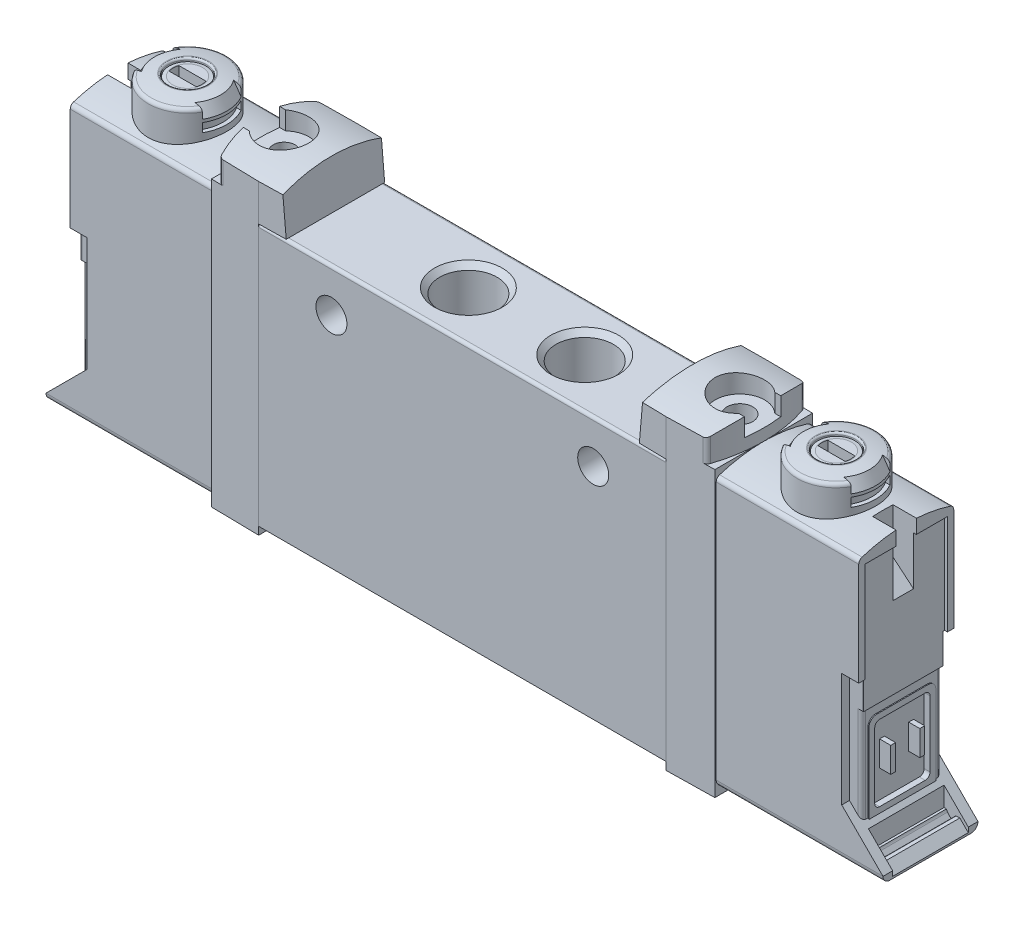
from build123d import *

# Parameters (mm, degrees)
BOSS_EXTRUDE1_DEPTH      = 21
BOSS_EXTRUDE1_DEPTH_BACK = 21
CUT_EXTRUDE1_DEPTH       = 6
CUT_EXTRUDE1_DEPTH_BACK  = 6
SKETCH2_R                = 1.6
CUT_EXTRUDE2_DEPTH       = 6
CUT_EXTRUDE2_DEPTH_BACK  = 6
SKETCH3_R                = 1.6
HOLE1_D                  = 5.917
HOLE1_DEPTH              = 6.8
HOLE1_CSINK_D            = 7
HOLE1_CSINK_ANGLE        = 90
HOLE2_D                  = 5.917
HOLE2_DEPTH              = 6.8
HOLE2_CSINK_D            = 7
HOLE2_CSINK_ANGLE        = 90
HOLE3_D                  = 3
HOLE3_DEPTH              = 6.7
HOLE4_D                  = 3
HOLE4_DEPTH              = 6.7
BOSS_EXTRUDE2_DEPTH      = 32.5
BOSS_EXTRUDE3_DEPTH      = 4.7
CUT_EXTRUDE3_DEPTH       = 5
CUT_EXTRUDE4_DEPTH       = 6
CUT_EXTRUDE4_DEPTH_BACK  = 6
BOSS_EXTRUDE4_DEPTH      = 17.2
CUT_EXTRUDE5_DEPTH       = 6
CUT_EXTRUDE5_DEPTH_BACK  = 6
BOSS_EXTRUDE5_DEPTH      = 12
BOSS_EXTRUDE6_DEPTH      = 3.1
BOSS_EXTRUDE7_DEPTH      = 0.1
CUT_EXTRUDE6_DEPTH       = 0.5
CUT_EXTRUDE6_DEPTH_BACK  = 0.5
BOSS_EXTRUDE8_DEPTH      = 2.6
CUT_EXTRUDE7_DEPTH       = 3
BOSS_EXTRUDE9_DEPTH      = 32.5
BOSS_EXTRUDE10_DEPTH     = 4.7
CUT_EXTRUDE8_DEPTH       = 32
CUT_EXTRUDE8_DEPTH_BACK  = 32
CUT_EXTRUDE9_DEPTH       = 2
CUT_EXTRUDE10_DEPTH      = 6
CUT_EXTRUDE10_DEPTH_BACK = 6
CUT_EXTRUDE11_DEPTH      = 5
BOSS_EXTRUDE11_START     = -17.2
BOSS_EXTRUDE11_DEPTH     = 17.2
CUT_EXTRUDE12_DEPTH      = 6
CUT_EXTRUDE12_DEPTH_BACK = 6
BOSS_EXTRUDE12_DEPTH     = 12
BOSS_EXTRUDE13_DEPTH     = 3.1
BOSS_EXTRUDE14_START     = -0.1
BOSS_EXTRUDE14_DEPTH     = 0.1
CUT_EXTRUDE13_DEPTH      = 0.5
CUT_EXTRUDE13_DEPTH_BACK = 0.5
BOSS_EXTRUDE15_DEPTH     = 2.6
SKETCH43_W               = 4.05
SKETCH43_H               = 5.3
SKETCH44_W               = 4.05
SKETCH44_H               = 5.3
SKETCH47_R               = 6
CUT_EXTRUDE14_DEPTH      = 3
SKETCH48_R               = 6
CUT_EXTRUDE15_DEPTH      = 3
CUT_EXTRUDE16_DEPTH      = 2.15
CUT_EXTRUDE17_DEPTH      = 2.15
CUT_EXTRUDE18_DEPTH      = 3.9
CUT_EXTRUDE18_DEPTH_BACK = 3.9
CUT_EXTRUDE19_DEPTH      = 3.9
CUT_EXTRUDE19_DEPTH_BACK = 3.9
CUT_EXTRUDE20_DEPTH      = 1.05
CUT_EXTRUDE20_DEPTH_BACK = 1.05
CUT_EXTRUDE21_DEPTH      = 1.05
CUT_EXTRUDE21_DEPTH_BACK = 1.05
CUT_EXTRUDE22_DEPTH      = 3.9
CUT_EXTRUDE22_DEPTH_BACK = 3.9
CUT_EXTRUDE23_DEPTH      = 3.9
CUT_EXTRUDE23_DEPTH_BACK = 3.9
CUT_EXTRUDE24_DEPTH      = 3.9
CUT_EXTRUDE24_DEPTH_BACK = 3.9
SKETCH62_W               = 8.5
SKETCH62_H               = 14
CUT_EXTRUDE25_DEPTH      = 2.8
SKETCH63_W               = 8.5
SKETCH63_H               = 14
CUT_EXTRUDE26_DEPTH      = 2.8


with BuildPart() as part:
    # Sketch1 → Boss-Extrude1 (new, two sides: drawn at the far end of the back side and taken through both)
    with BuildSketch(Plane(origin=(0, 0, 0), x_dir=(0, 0, -1), z_dir=(1, 0, 0)).offset(-BOSS_EXTRUDE1_DEPTH_BACK)):
        with BuildLine():
            Line((-5.125, 0), (5.125, 0))
            Line((5.125, 0), (5.125, 26.7))
            ThreePointArc((5.125, 26.7), (5.037132034, 26.912132034), (4.825, 27))
            Line((4.825, 27), (-4.825, 27))
            ThreePointArc((-4.825, 27), (-5.037132034, 26.912132034), (-5.125, 26.7))
            Line((-5.125, 26.7), (-5.125, 0))
        make_face()
    extrude(amount=BOSS_EXTRUDE1_DEPTH + BOSS_EXTRUDE1_DEPTH_BACK)

    # Sketch2 → Cut-Extrude1 (cut, two sides: drawn at the far end of the back side and taken through both)
    with BuildSketch(Plane.XY.offset(-CUT_EXTRUDE1_DEPTH_BACK)):
        with Locations((13.5, 22.6)):
            Circle(SKETCH2_R)
    extrude(amount=CUT_EXTRUDE1_DEPTH + CUT_EXTRUDE1_DEPTH_BACK, mode=Mode.SUBTRACT)

    # Sketch3 → Cut-Extrude2 (cut, two sides: drawn at the far end of the back side and taken through both)
    with BuildSketch(Plane.XY.offset(-CUT_EXTRUDE2_DEPTH_BACK)):
        with Locations((-13.5, 22.6)):
            Circle(SKETCH3_R)
    extrude(amount=CUT_EXTRUDE2_DEPTH + CUT_EXTRUDE2_DEPTH_BACK, mode=Mode.SUBTRACT)

    # Sketch4 → Cut-Revolve1 (revolve, cut)
    with BuildSketch(Plane.XY.offset(-0.005)):
        Polygon((12.5, 13.5), (14.6, 13.5), (14.6, 6.8), (15.4585, 6.8), (15.4585, 0.5415), (16, 0), (12.5, 0), align=None)
    revolve(axis=Axis((12.5, 0, -0.005), (0, 1, 0)), mode=Mode.SUBTRACT)

    # Sketch5 → Cut-Revolve2 (revolve, cut)
    with BuildSketch(Plane.XY.offset(-0.005)):
        Polygon((1.5, 20.012435565), (3.6, 18.8), (3.6, 6.8), (4.4585, 6.8), (4.4585, 0.5415), (5, 0), (1.5, 0), align=None)
    revolve(axis=Axis((1.5, 0, -0.005), (0, 1, 0)), mode=Mode.SUBTRACT)

    # Sketch6 → Cut-Revolve3 (revolve, cut)
    with BuildSketch(Plane.XY.offset(-0.005)):
        Polygon((-9.5, 13.5), (-7.4, 13.5), (-7.4, 6.8), (-6.5415, 6.8), (-6.5415, 0.5415), (-6, 0), (-9.5, 0), align=None)
    revolve(axis=Axis((-9.5, 0, -0.005), (0, 1, 0)), mode=Mode.SUBTRACT)

    # Hole1
    with Locations(Plane(origin=(0, 27, 0), x_dir=(-1, 0, 0), z_dir=(0, 1, 0))):
        with Locations((4.5, 0)):
            CounterSinkHole(HOLE1_D / 2, HOLE1_CSINK_D / 2, depth=HOLE1_DEPTH, counter_sink_angle=HOLE1_CSINK_ANGLE)

    # Hole2
    with Locations(Plane(origin=(0, 27, 0), x_dir=(-1, 0, 0), z_dir=(0, 1, 0))):
        with Locations((-7.5, 0)):
            CounterSinkHole(HOLE2_D / 2, HOLE2_CSINK_D / 2, depth=HOLE2_DEPTH, counter_sink_angle=HOLE2_CSINK_ANGLE)

    # Hole3
    with Locations(Plane(origin=(0, 20.2, 0), x_dir=(-1, 0, 0), z_dir=(0, 1, 0))):
        with Locations((4.5, 1)):
            Hole(HOLE3_D / 2, depth=HOLE3_DEPTH)

    # Hole4
    with Locations(Plane(origin=(0, 20.2, 0), x_dir=(-1, 0, 0), z_dir=(0, 1, 0))):
        with Locations((-7.5, -1)):
            Hole(HOLE4_D / 2, depth=HOLE4_DEPTH)

    # Sketch15 → Boss-Extrude2 (add)
    with BuildSketch(Plane(origin=(0, -0.8, 0), x_dir=(-1, 0, 0), z_dir=(0, 1, 0))):
        Polygon((-21, 5.125), (-25.96, 5.038422878), (-25.96, -5.038422878), (-21, -5.125), align=None)
    extrude(amount=BOSS_EXTRUDE2_DEPTH)

    # Sketch16 → Boss-Extrude3 (add)
    with BuildSketch(Plane(origin=(0, 27, 0), x_dir=(-1, 0, 0), z_dir=(0, 1, 0))):
        Polygon((-18.21, 5.076300369), (-21, 5.125), (-21, -5.125), (-18.21, -5.076300369), align=None)
    extrude(amount=BOSS_EXTRUDE3_DEPTH)

    # Sketch18 → Cut-Extrude3 (cut)
    with BuildSketch(Plane(origin=(0, 28.5, 0), x_dir=(-1, 0, 0), z_dir=(0, 1, 0))):
        with BuildLine():
            Line((-21, 5.125), (-21, 6.125))
            Line((-21, 6.125), (-31, 6.125))
            Line((-31, 6.125), (-31, -6.125))
            Line((-31, -6.125), (-21, -6.125))
            Line((-21, -6.125), (-21, -5.125))
            Line((-21, -5.125), (-24.733070492, -5.059839012))
            ThreePointArc((-24.733070492, -5.059839012), (-25.020599639, -4.962696454), (-25.198976836, -4.717153661))
            ThreePointArc((-25.198976836, -4.717153661), (-25.96, -2.2e-08), (-25.19897685, 4.717153619))
            ThreePointArc((-25.19897685, 4.717153619), (-25.020599657, 4.962696441), (-24.733070492, 5.059839012))
            Line((-24.733070492, 5.059839012), (-21, 5.125))
        make_face()
    extrude(amount=CUT_EXTRUDE3_DEPTH, mode=Mode.SUBTRACT)

    # Sketch19 → Cut-Extrude4 (cut, two sides: drawn at the far end of the back side and taken through both)
    with BuildSketch(Plane.XY.offset(-CUT_EXTRUDE4_DEPTH_BACK)):
        Polygon((13.21, 27), (18.21, 27), (18.647443318, 32), (13.21, 32), align=None)
    extrude(amount=CUT_EXTRUDE4_DEPTH + CUT_EXTRUDE4_DEPTH_BACK, mode=Mode.SUBTRACT)

    # Sketch20 → Boss-Extrude4 (add)
    with BuildSketch(Plane(origin=(25.96, 0, 0), x_dir=(0, 0, -1), z_dir=(1, 0, 0))):
        with BuildLine():
            Line((-4.9, 27.316294728), (-4.9, 0.7))
            ThreePointArc((-4.9, 0.7), (-4.694974747, 0.205025253), (-4.2, 0))
            Line((-4.2, 0), (4.2, 0))
            ThreePointArc((4.2, 0), (4.694974747, 0.205025253), (4.9, 0.7))
            Line((4.9, 0.7), (4.9, 27.316294728))
            ThreePointArc((4.9, 27.316294728), (4.803647153, 27.611369254), (4.551724095, 27.792718697))
            ThreePointArc((4.551724095, 27.792718697), (-2.2e-08, 28.5), (-4.551724138, 27.792718684))
            ThreePointArc((-4.551724138, 27.792718684), (-4.803647166, 27.611369236), (-4.9, 27.316294728))
        make_face()
    extrude(amount=BOSS_EXTRUDE4_DEPTH)

    # Sketch21 → Cut-Extrude5 (cut, two sides: drawn at the far end of the back side and taken through both)
    with BuildSketch(Plane.XY.offset(-CUT_EXTRUDE5_DEPTH_BACK)):
        Polygon((38.9067, 16.7), (38.9067, 4.9533), (43.16, 0.7), (43.16, 30), (40.66, 30), (40.66, 16.7), align=None)
    extrude(amount=CUT_EXTRUDE5_DEPTH + CUT_EXTRUDE5_DEPTH_BACK, mode=Mode.SUBTRACT)

    # Sketch22 → Boss-Extrude5 (add)
    with BuildSketch(Plane(origin=(0, 13.6, 0), x_dir=(-1, 0, 0), z_dir=(0, 1, 0))):
        with BuildLine():
            Line((-38.16, 4.1), (-39.76, 4.1))
            ThreePointArc((-39.76, 4.1), (-40.042842712, 3.982842712), (-40.16, 3.7))
            Line((-40.16, 3.7), (-40.16, -3.7))
            ThreePointArc((-40.16, -3.7), (-40.042842712, -3.982842712), (-39.76, -4.1))
            Line((-39.76, -4.1), (-38.16, -4.1))
            Line((-38.16, -4.1), (-38.16, 4.1))
        make_face()
    extrude(amount=-BOSS_EXTRUDE5_DEPTH)

    # Sketch23 → Boss-Extrude6 (add)
    with BuildSketch(Plane(origin=(0, 13.6, 0), x_dir=(-1, 0, 0), z_dir=(0, 1, 0))):
        with BuildLine():
            Line((-37.66, 4.1), (-40.26, 4.1))
            ThreePointArc((-40.26, 4.1), (-40.542842712, 3.982842712), (-40.66, 3.7))
            Line((-40.66, 3.7), (-40.66, -3.7))
            ThreePointArc((-40.66, -3.7), (-40.542842712, -3.982842712), (-40.26, -4.1))
            Line((-40.26, -4.1), (-37.66, -4.1))
            Line((-37.66, -4.1), (-37.66, 4.1))
        make_face()
    extrude(amount=BOSS_EXTRUDE6_DEPTH)

    # Sketch24 → Boss-Extrude7 (add)
    with BuildSketch(Plane(origin=(40.16, 0, 0), x_dir=(0, 0, -1), z_dir=(1, 0, 0))):
        with BuildLine():
            Line((-3.45, 0), (3.45, 0))
            Line((3.45, 0), (3.45, 11.8))
            ThreePointArc((3.45, 11.8), (3.215685425, 12.365685425), (2.65, 12.6))
            Line((2.65, 12.6), (-2.65, 12.6))
            ThreePointArc((-2.65, 12.6), (-3.215685425, 12.365685425), (-3.45, 11.8))
            Line((-3.45, 11.8), (-3.45, 0))
        make_face()
    extrude(amount=BOSS_EXTRUDE7_DEPTH)

    # Sketch25 → Cut-Extrude6 (cut, two sides: drawn at the far end of the back side and taken through both)
    with BuildSketch(Plane(origin=(40.16, 0, 0), x_dir=(0, 0, -1), z_dir=(1, 0, 0)).offset(-CUT_EXTRUDE6_DEPTH_BACK)):
        with BuildLine():
            Line((-2.85, 11.5), (-2.85, 4.7))
            ThreePointArc((-2.85, 4.7), (-2.703553391, 4.346446609), (-2.35, 4.2))
            Line((-2.35, 4.2), (2.35, 4.2))
            ThreePointArc((2.35, 4.2), (2.703553391, 4.346446609), (2.85, 4.7))
            Line((2.85, 4.7), (2.85, 11.5))
            ThreePointArc((2.85, 11.5), (2.703553391, 11.853553391), (2.35, 12))
            Line((2.35, 12), (-2.35, 12))
            ThreePointArc((-2.35, 12), (-2.703553391, 11.853553391), (-2.85, 11.5))
        make_face()
    extrude(amount=CUT_EXTRUDE6_DEPTH + CUT_EXTRUDE6_DEPTH_BACK, mode=Mode.SUBTRACT)

    # Sketch26 → Boss-Extrude8 (add)
    with BuildSketch(Plane(origin=(0, 9.65, 0), x_dir=(-1, 0, 0), z_dir=(0, 1, 0))):
        Polygon((-35.81, -1.75), (-35.81, 1.75), (-40.81, 1.75), (-40.81, 1.25), (-36.31, 1.25), (-36.31, -1.25), (-40.81, -1.25), (-40.81, -1.75), align=None)
    extrude(amount=-BOSS_EXTRUDE8_DEPTH)

    # Sketch27 → Cut-Revolve4 (revolve, cut)
    with BuildSketch(Plane.XY):
        Polygon((23.5, 29.7), (24.825, 29.7), (24.625, -0.8), (23.5, -0.8), align=None)
    revolve(axis=Axis((23.5, -0.8, 0), (0, 1, 0)), mode=Mode.SUBTRACT)

    # Sketch28 → Cut-Extrude7 (cut)
    with BuildSketch(Plane(origin=(0, 29.7, 0), x_dir=(-1, 0, 0), z_dir=(0, 1, 0))):
        with BuildLine():
            Line((-25.228257793, 1.875), (-27, 1.875))
            Line((-27, 1.875), (-27, -1.875))
            Line((-27, -1.875), (-25.228257793, -1.875))
            ThreePointArc((-25.228257793, -1.875), (-20.95, 0), (-25.228257793, 1.875))
        make_face()
    extrude(amount=CUT_EXTRUDE7_DEPTH, mode=Mode.SUBTRACT)

    # Sketch29 → Boss-Extrude9 (add)
    with BuildSketch(Plane(origin=(0, -0.8, 0), x_dir=(-1, 0, 0), z_dir=(0, 1, 0))):
        Polygon((25.96, -5.038422878), (25.96, 5.038422878), (21, 5.125), (21, -5.125), align=None)
    extrude(amount=BOSS_EXTRUDE9_DEPTH)

    # Sketch30 → Boss-Extrude10 (add)
    with BuildSketch(Plane(origin=(0, 27, 0), x_dir=(-1, 0, 0), z_dir=(0, 1, 0))):
        Polygon((21, -5.125), (21, 5.125), (18.21, 5.076300369), (18.21, -5.076300369), align=None)
    extrude(amount=BOSS_EXTRUDE10_DEPTH)

    # Sketch17 → Cut-Extrude8 (cut, two sides: drawn at the far end of the back side and taken through both)
    with BuildSketch(Plane(origin=(0, 0, 0), x_dir=(0, 0, -1), z_dir=(1, 0, 0)).offset(-CUT_EXTRUDE8_DEPTH_BACK)):
        with BuildLine():
            Line((-5.125, 37), (-5.125, 30.797318007))
            ThreePointArc((-5.125, 30.797318007), (0, 31.7), (5.125, 30.797318007))
            Line((5.125, 30.797318007), (5.125, 37))
            Line((5.125, 37), (-5.125, 37))
        make_face()
    extrude(amount=CUT_EXTRUDE8_DEPTH + CUT_EXTRUDE8_DEPTH_BACK, mode=Mode.SUBTRACT)

    # Sketch31 → Cut-Extrude9 (cut)
    with BuildSketch(Plane(origin=(0, 29.7, 0), x_dir=(-1, 0, 0), z_dir=(0, 1, 0))):
        with BuildLine():
            Line((27, -1.875), (27, 1.875))
            Line((27, 1.875), (25.228257793, 1.875))
            ThreePointArc((25.228257793, 1.875), (20.95, 0), (25.228257793, -1.875))
            Line((25.228257793, -1.875), (27, -1.875))
        make_face()
    extrude(amount=CUT_EXTRUDE9_DEPTH, mode=Mode.SUBTRACT)

    # Sketch32 → Hole5 (revolve, cut)
    with BuildSketch(Plane(origin=(-23.5, 29.7, 0), x_dir=(0, 0, 1), z_dir=(1, 0, 0))):
        Polygon((0, 0), (0, 30.5), (1.325, 30.5), (1.125, 0), align=None)
    revolve(axis=Axis((-23.5, -80.3, 0), (0, 1, 0)), mode=Mode.SUBTRACT)

    # Sketch34 → Cut-Extrude10 (cut, two sides: drawn at the far end of the back side and taken through both)
    with BuildSketch(Plane.XY.offset(-CUT_EXTRUDE10_DEPTH_BACK)):
        Polygon((-18.647443318, 32), (-18.21, 27), (-13.21, 27), (-13.21, 32), align=None)
    extrude(amount=CUT_EXTRUDE10_DEPTH + CUT_EXTRUDE10_DEPTH_BACK, mode=Mode.SUBTRACT)

    # Sketch35 → Cut-Extrude11 (cut)
    with BuildSketch(Plane(origin=(0, 28.5, 0), x_dir=(-1, 0, 0), z_dir=(0, 1, 0))):
        with BuildLine():
            Line((31, -6.125), (31, 6.125))
            Line((31, 6.125), (21, 6.125))
            Line((21, 6.125), (21, 5.125))
            Line((21, 5.125), (24.733070492, 5.059839012))
            ThreePointArc((24.733070492, 5.059839012), (25.020599657, 4.962696441), (25.19897685, 4.717153619))
            ThreePointArc((25.19897685, 4.717153619), (25.96, 0), (25.19897685, -4.717153619))
            ThreePointArc((25.19897685, -4.717153619), (25.020599657, -4.962696441), (24.733070492, -5.059839012))
            Line((24.733070492, -5.059839012), (21, -5.125))
            Line((21, -5.125), (21, -6.125))
            Line((21, -6.125), (31, -6.125))
        make_face()
    extrude(amount=CUT_EXTRUDE11_DEPTH, mode=Mode.SUBTRACT)

    # Sketch36 → Boss-Extrude11 (add)
    with BuildSketch(Plane(origin=(-25.96, 0, 0), x_dir=(0, 0, -1), z_dir=(1, 0, 0)).offset(BOSS_EXTRUDE11_START)):
        with BuildLine():
            Line((-4.9, 27.316294728), (-4.9, 0.7))
            ThreePointArc((-4.9, 0.7), (-4.694974747, 0.205025253), (-4.2, 0))
            Line((-4.2, 0), (4.2, 0))
            ThreePointArc((4.2, 0), (4.694974747, 0.205025253), (4.9, 0.7))
            Line((4.9, 0.7), (4.9, 27.316294728))
            ThreePointArc((4.9, 27.316294728), (4.803647153, 27.611369254), (4.551724095, 27.792718697))
            ThreePointArc((4.551724095, 27.792718697), (-2.2e-08, 28.5), (-4.551724138, 27.792718684))
            ThreePointArc((-4.551724138, 27.792718684), (-4.803647166, 27.611369236), (-4.9, 27.316294728))
        make_face()
    extrude(amount=BOSS_EXTRUDE11_DEPTH)

    # Sketch37 → Cut-Extrude12 (cut, two sides: drawn at the far end of the back side and taken through both)
    with BuildSketch(Plane.XY.offset(-CUT_EXTRUDE12_DEPTH_BACK)):
        Polygon((-43.16, 0.7), (-38.9067, 4.9533), (-38.9067, 16.7), (-40.66, 16.7), (-40.66, 30), (-43.16, 30), align=None)
    extrude(amount=CUT_EXTRUDE12_DEPTH + CUT_EXTRUDE12_DEPTH_BACK, mode=Mode.SUBTRACT)

    # Sketch38 → Boss-Extrude12 (add)
    with BuildSketch(Plane(origin=(0, 13.6, 0), x_dir=(-1, 0, 0), z_dir=(0, 1, 0))):
        with BuildLine():
            Line((39.76, 4.1), (38.16, 4.1))
            Line((38.16, 4.1), (38.16, -4.1))
            Line((38.16, -4.1), (39.76, -4.1))
            ThreePointArc((39.76, -4.1), (40.042842712, -3.982842712), (40.16, -3.7))
            Line((40.16, -3.7), (40.16, 3.7))
            ThreePointArc((40.16, 3.7), (40.042842712, 3.982842712), (39.76, 4.1))
        make_face()
    extrude(amount=-BOSS_EXTRUDE12_DEPTH)

    # Sketch39 → Boss-Extrude13 (add)
    with BuildSketch(Plane(origin=(0, 13.6, 0), x_dir=(-1, 0, 0), z_dir=(0, 1, 0))):
        with BuildLine():
            Line((40.26, 4.1), (37.66, 4.1))
            Line((37.66, 4.1), (37.66, -4.1))
            Line((37.66, -4.1), (40.26, -4.1))
            ThreePointArc((40.26, -4.1), (40.542842712, -3.982842712), (40.66, -3.7))
            Line((40.66, -3.7), (40.66, 3.7))
            ThreePointArc((40.66, 3.7), (40.542842712, 3.982842712), (40.26, 4.1))
        make_face()
    extrude(amount=BOSS_EXTRUDE13_DEPTH)

    # Sketch40 → Boss-Extrude14 (add)
    with BuildSketch(Plane(origin=(-40.16, 0, 0), x_dir=(0, 0, -1), z_dir=(1, 0, 0)).offset(BOSS_EXTRUDE14_START)):
        with BuildLine():
            Line((-3.45, 0), (3.45, 0))
            Line((3.45, 0), (3.45, 11.8))
            ThreePointArc((3.45, 11.8), (3.215685425, 12.365685425), (2.65, 12.6))
            Line((2.65, 12.6), (-2.65, 12.6))
            ThreePointArc((-2.65, 12.6), (-3.215685425, 12.365685425), (-3.45, 11.8))
            Line((-3.45, 11.8), (-3.45, 0))
        make_face()
    extrude(amount=BOSS_EXTRUDE14_DEPTH)

    # Sketch41 → Cut-Extrude13 (cut, two sides: drawn at the far end of the back side and taken through both)
    with BuildSketch(Plane(origin=(-40.16, 0, 0), x_dir=(0, 0, -1), z_dir=(1, 0, 0)).offset(-CUT_EXTRUDE13_DEPTH_BACK)):
        with BuildLine():
            Line((-2.85, 11.5), (-2.85, 4.7))
            ThreePointArc((-2.85, 4.7), (-2.703553391, 4.346446609), (-2.35, 4.2))
            Line((-2.35, 4.2), (2.35, 4.2))
            ThreePointArc((2.35, 4.2), (2.703553391, 4.346446609), (2.85, 4.7))
            Line((2.85, 4.7), (2.85, 11.5))
            ThreePointArc((2.85, 11.5), (2.703553391, 11.853553391), (2.35, 12))
            Line((2.35, 12), (-2.35, 12))
            ThreePointArc((-2.35, 12), (-2.703553391, 11.853553391), (-2.85, 11.5))
        make_face()
    extrude(amount=CUT_EXTRUDE13_DEPTH + CUT_EXTRUDE13_DEPTH_BACK, mode=Mode.SUBTRACT)

    # Sketch42 → Boss-Extrude15 (add)
    with BuildSketch(Plane(origin=(0, 9.65, 0), x_dir=(-1, 0, 0), z_dir=(0, 1, 0))):
        Polygon((40.81, 1.75), (35.81, 1.75), (35.81, -1.75), (40.81, -1.75), (40.81, -1.25), (36.31, -1.25), (36.31, 1.25), (40.81, 1.25), align=None)
    extrude(amount=-BOSS_EXTRUDE15_DEPTH)

    # Sketch43 → Revolve1 (revolve)
    with BuildSketch(Plane.XY):
        with Locations((35.485, 29.015)):
            Rectangle(SKETCH43_W, SKETCH43_H)
    revolve(axis=Axis((33.46, 26.365, 0), (0, 1, 0)))

    # Sketch44 → Revolve2 (revolve)
    with BuildSketch(Plane.XY):
        with Locations((-31.435, 29.015)):
            Rectangle(SKETCH44_W, SKETCH44_H)
    revolve(axis=Axis((-33.46, 26.365, 0), (0, 1, 0)))

    # Sketch47 → Cut-Extrude14 (cut)
    with BuildSketch(Plane(origin=(0, 29.1, 0), x_dir=(-1, 0, 0), z_dir=(0, 1, 0))):
        with Locations((-33.46, 0)):
            Circle(SKETCH47_R)
        with BuildLine():
            Line((-28.877424305, -2), (-30.710454583, -2))
            ThreePointArc((-30.710454583, -2), (-30.06, 0), (-30.710454583, 2))
            Line((-30.710454583, 2), (-28.877424305, 2))
            ThreePointArc((-28.877424305, 2), (-33.46, 5), (-38.042575695, 2))
            Line((-38.042575695, 2), (-36.209545417, 2))
            ThreePointArc((-36.209545417, 2), (-36.86, 0), (-36.209545417, -2))
            Line((-36.209545417, -2), (-38.042575695, -2))
            ThreePointArc((-38.042575695, -2), (-33.46, -5), (-28.877424305, -2))
        make_face(mode=Mode.SUBTRACT)
    extrude(amount=CUT_EXTRUDE14_DEPTH, mode=Mode.SUBTRACT)

    # Sketch48 → Cut-Extrude15 (cut)
    with BuildSketch(Plane(origin=(0, 29.1, 0), x_dir=(-1, 0, 0), z_dir=(0, 1, 0))):
        with Locations((33.46, 0)):
            Circle(SKETCH48_R)
        with BuildLine():
            Line((38.042575695, -2), (36.209545417, -2))
            ThreePointArc((36.209545417, -2), (36.86, 0), (36.209545417, 2))
            Line((36.209545417, 2), (38.042575695, 2))
            ThreePointArc((38.042575695, 2), (33.46, 5), (28.877424305, 2))
            Line((28.877424305, 2), (30.710454583, 2))
            ThreePointArc((30.710454583, 2), (30.06, 0), (30.710454583, -2))
            Line((30.710454583, -2), (28.877424305, -2))
            ThreePointArc((28.877424305, -2), (33.46, -5), (38.042575695, -2))
        make_face(mode=Mode.SUBTRACT)
    extrude(amount=CUT_EXTRUDE15_DEPTH, mode=Mode.SUBTRACT)

    # Sketch49 → Revolve3 (revolve)
    with BuildSketch(Plane.XY):
        Polygon((36.86, 26.365), (37.51, 26.365), (37.51, 29.115), (37.11, 29.115), (37.11, 30.015), (37.51, 30.015), (37.51, 30.315), (36.86, 31.440833025), align=None)
    revolve(axis=Axis((33.46, 26.365, 0), (0, 1, 0)))

    # Sketch50 → Revolve4 (revolve)
    with BuildSketch(Plane.XY):
        Polygon((-30.06, 26.365), (-29.41, 26.365), (-29.41, 29.115), (-29.81, 29.115), (-29.81, 30.015), (-29.41, 30.015), (-29.41, 30.315), (-30.06, 31.440833025), align=None)
    revolve(axis=Axis((-33.46, 26.365, 0), (0, 1, 0)))

    # Sketch45 → Cut-Revolve5 (revolve, cut)
    with BuildSketch(Plane.XY):
        with BuildLine():
            Line((33.46, 32.365), (38.46, 32.365))
            Line((38.46, 32.365), (38.46, 28.865))
            Line((38.46, 28.865), (37.51, 28.865))
            Line((37.51, 28.865), (37.51, 30.961389214))
            ThreePointArc((37.51, 30.961389214), (37.426227766, 31.206338188), (37.21, 31.348687548))
            ThreePointArc((37.21, 31.348687548), (36.428766289, 31.528279455), (35.639054054, 31.665880143))
            ThreePointArc((35.639054054, 31.665880143), (35.479253701, 31.61934706), (35.41, 31.468001741))
            Line((35.41, 31.468001741), (35.41, 30.295))
            Line((35.41, 30.295), (33.46, 30.295))
            Line((33.46, 30.295), (33.46, 32.365))
        make_face()
    revolve(axis=Axis((33.46, 26.365, 0), (0, 1, 0)), mode=Mode.SUBTRACT)

    # Sketch51 → Cut-Revolve6 (revolve, cut)
    with BuildSketch(Plane.XY):
        with BuildLine():
            Line((-33.46, 32.365), (-28.46, 32.365))
            Line((-28.46, 32.365), (-28.46, 28.865))
            Line((-28.46, 28.865), (-29.41, 28.865))
            Line((-29.41, 28.865), (-29.41, 30.961389214))
            ThreePointArc((-29.41, 30.961389214), (-29.493772234, 31.206338188), (-29.71, 31.348687548))
            ThreePointArc((-29.71, 31.348687548), (-30.491233711, 31.528279455), (-31.280945946, 31.665880143))
            ThreePointArc((-31.280945946, 31.665880143), (-31.440746299, 31.61934706), (-31.51, 31.468001741))
            Line((-31.51, 31.468001741), (-31.51, 30.295))
            Line((-31.51, 30.295), (-33.46, 30.295))
            Line((-33.46, 30.295), (-33.46, 32.365))
        make_face()
    revolve(axis=Axis((-33.46, 26.365, 0), (0, 1, 0)), mode=Mode.SUBTRACT)

    # Sketch46 → Revolve5 (revolve)
    with BuildSketch(Plane.XY):
        with BuildLine():
            Line((33.46, 31.41), (35.004231514, 31.41))
            Line((35.004231514, 31.41), (35.36, 31.36))
            Line((35.36, 31.36), (35.36, 29.71))
            ThreePointArc((35.36, 29.71), (35.506446609, 29.356446609), (35.86, 29.21))
            Line((35.86, 29.21), (36.01, 29.21))
            Line((36.01, 29.21), (36.01, 25.41))
            Line((36.01, 25.41), (33.46, 25.41))
            Line((33.46, 25.41), (33.46, 31.41))
        make_face()
    revolve(axis=Axis((33.46, 25.41, 0), (0, 1, 0)))

    # Sketch52 → Revolve6 (revolve)
    with BuildSketch(Plane.XY):
        with BuildLine():
            Line((-33.46, 31.41), (-31.915768486, 31.41))
            Line((-31.915768486, 31.41), (-31.56, 31.36))
            Line((-31.56, 31.36), (-31.56, 29.71))
            ThreePointArc((-31.56, 29.71), (-31.413553391, 29.356446609), (-31.06, 29.21))
            Line((-31.06, 29.21), (-30.91, 29.21))
            Line((-30.91, 29.21), (-30.91, 25.41))
            Line((-30.91, 25.41), (-33.46, 25.41))
            Line((-33.46, 25.41), (-33.46, 31.41))
        make_face()
    revolve(axis=Axis((-33.46, 25.41, 0), (0, 1, 0)))

    # Sketch53 → Cut-Extrude16 (cut)
    with BuildSketch(Plane(origin=(0, 31.41, 0), x_dir=(-1, 0, 0), z_dir=(0, 1, 0))):
        with BuildLine():
            Line((-32.067017588, 0.5), (-34.852982412, 0.5))
            ThreePointArc((-34.852982412, 0.5), (-34.94, 0), (-34.852982412, -0.5))
            Line((-34.852982412, -0.5), (-32.067017588, -0.5))
            ThreePointArc((-32.067017588, -0.5), (-31.98, 0), (-32.067017588, 0.5))
        make_face()
    extrude(amount=-CUT_EXTRUDE16_DEPTH, mode=Mode.SUBTRACT)

    # Sketch54 → Cut-Extrude17 (cut)
    with BuildSketch(Plane(origin=(0, 31.41, 0), x_dir=(-1, 0, 0), z_dir=(0, 1, 0))):
        with BuildLine():
            Line((34.852982412, 0.5), (32.067017588, 0.5))
            ThreePointArc((32.067017588, 0.5), (31.98, 0), (32.067017588, -0.5))
            Line((32.067017588, -0.5), (34.852982412, -0.5))
            ThreePointArc((34.852982412, -0.5), (34.94, 0), (34.852982412, 0.5))
        make_face()
    extrude(amount=-CUT_EXTRUDE17_DEPTH, mode=Mode.SUBTRACT)

    # Sketch55 → Cut-Extrude18 (cut, two sides: drawn at the far end of the back side and taken through both)
    with BuildSketch(Plane.XY.offset(-CUT_EXTRUDE18_DEPTH_BACK)):
        Polygon((40.66, 4.2), (40.66, 1.2), (42.16, 1.2), (43.16, 0.2), (43.16, 4.2), align=None)
    extrude(amount=CUT_EXTRUDE18_DEPTH + CUT_EXTRUDE18_DEPTH_BACK, mode=Mode.SUBTRACT)

    # Sketch56 → Cut-Extrude19 (cut, two sides: drawn at the far end of the back side and taken through both)
    with BuildSketch(Plane.XY.offset(-CUT_EXTRUDE19_DEPTH_BACK)):
        Polygon((-43.16, 0.2), (-42.16, 1.2), (-40.66, 1.2), (-40.66, 4.2), (-43.16, 4.2), align=None)
    extrude(amount=CUT_EXTRUDE19_DEPTH + CUT_EXTRUDE19_DEPTH_BACK, mode=Mode.SUBTRACT)

    # Sketch57 → Cut-Extrude20 (cut, two sides: drawn at the far end of the back side and taken through both)
    with BuildSketch(Plane.XY.offset(-CUT_EXTRUDE20_DEPTH_BACK)):
        Polygon((38.256, 23.774), (45.756, 17.480752766), (45.756, 28.534), (38.256, 28.534), align=None)
    extrude(amount=CUT_EXTRUDE20_DEPTH + CUT_EXTRUDE20_DEPTH_BACK, mode=Mode.SUBTRACT)

    # Sketch58 → Cut-Extrude21 (cut, two sides: drawn at the far end of the back side and taken through both)
    with BuildSketch(Plane.XY.offset(-CUT_EXTRUDE21_DEPTH_BACK)):
        Polygon((-45.756, 17.480752766), (-38.256, 23.774), (-38.256, 28.534), (-45.756, 28.534), align=None)
    extrude(amount=CUT_EXTRUDE21_DEPTH + CUT_EXTRUDE21_DEPTH_BACK, mode=Mode.SUBTRACT)

    # Sketch59 → Cut-Extrude22 (cut, two sides: drawn at the far end of the back side and taken through both)
    with BuildSketch(Plane.XY.offset(-CUT_EXTRUDE22_DEPTH_BACK)):
        Polygon((-43.2, 0.2), (-42.2, 1.2), (-40.5, 1.2), (-40.5, 4.2), (-43.2, 4.2), align=None)
    extrude(amount=CUT_EXTRUDE22_DEPTH + CUT_EXTRUDE22_DEPTH_BACK, mode=Mode.SUBTRACT)

    # Sketch60 → Cut-Extrude23 (cut, two sides: drawn at the far end of the back side and taken through both)
    with BuildSketch(Plane.XY.offset(-CUT_EXTRUDE23_DEPTH_BACK)):
        with BuildLine():
            Line((41.019863416, 0.96928323), (41.504340902, 0.411955636))
            ThreePointArc((41.504340902, 0.411955636), (41.601773325, 0.339859436), (41.720546258, 0.31569481))
            Line((41.720546258, 0.31569481), (41.861178703, 0.318149558))
            ThreePointArc((41.861178703, 0.318149558), (41.939819149, 0.358652049), (41.955559632, 0.445698063))
            Line((41.955559632, 0.445698063), (41.815279973, 0.934911374))
            ThreePointArc((41.815279973, 0.934911374), (41.830504443, 1.021253635), (41.907916193, 1.062414192))
            Line((41.907916193, 1.062414192), (45.86, 1.200424))
            Line((45.86, 1.200424), (45.86, 1.953461291))
            Line((45.86, 1.953461291), (41.379768458, 1.797008158))
            ThreePointArc((41.379768458, 1.797008158), (40.938688169, 1.496687279), (41.019863416, 0.96928323))
        make_face()
    extrude(amount=CUT_EXTRUDE23_DEPTH + CUT_EXTRUDE23_DEPTH_BACK, mode=Mode.SUBTRACT)

    # Sketch61 → Cut-Extrude24 (cut, two sides: drawn at the far end of the back side and taken through both)
    with BuildSketch(Plane.XY.offset(-CUT_EXTRUDE24_DEPTH_BACK)):
        with BuildLine():
            Line((-45.86, 1.200424), (-41.907916193, 1.062414192))
            ThreePointArc((-41.907916193, 1.062414192), (-41.830504443, 1.021253635), (-41.815279973, 0.934911374))
            Line((-41.815279973, 0.934911374), (-41.955559632, 0.445698063))
            ThreePointArc((-41.955559632, 0.445698063), (-41.939819149, 0.358652049), (-41.861178703, 0.318149558))
            Line((-41.861178703, 0.318149558), (-41.720546258, 0.31569481))
            ThreePointArc((-41.720546258, 0.31569481), (-41.601773325, 0.339859436), (-41.504340902, 0.411955636))
            Line((-41.504340902, 0.411955636), (-41.019863416, 0.96928323))
            ThreePointArc((-41.019863416, 0.96928323), (-40.938688169, 1.496687279), (-41.379768458, 1.797008158))
            Line((-41.379768458, 1.797008158), (-45.86, 1.953461291))
            Line((-45.86, 1.953461291), (-45.86, 1.200424))
        make_face()
    extrude(amount=CUT_EXTRUDE24_DEPTH + CUT_EXTRUDE24_DEPTH_BACK, mode=Mode.SUBTRACT)

    # Sketch62 → Cut-Extrude25 (cut)
    with BuildSketch(Plane(origin=(43.16, 0, 0), x_dir=(0, 0, -1), z_dir=(1, 0, 0))):
        with Locations((0, 20.012)):
            Rectangle(SKETCH62_W, SKETCH62_H)
    extrude(amount=-CUT_EXTRUDE25_DEPTH, mode=Mode.SUBTRACT)

    # Sketch63 → Cut-Extrude26 (cut)
    with BuildSketch(Plane(origin=(-43.16, 0, 0), x_dir=(0, 0, -1), z_dir=(1, 0, 0))):
        with Locations((0, 20.012)):
            Rectangle(SKETCH63_W, SKETCH63_H)
    extrude(amount=CUT_EXTRUDE26_DEPTH, mode=Mode.SUBTRACT)


solid = part.part
